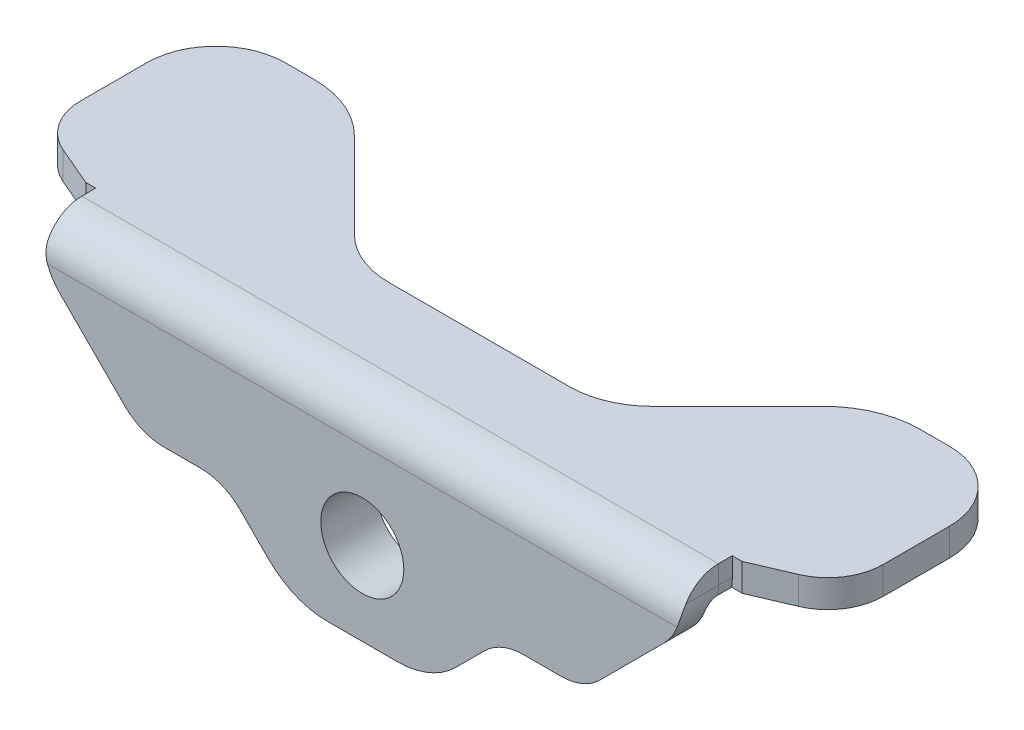
from build123d import *

# Parameters (mm, degrees)
BASE_FLANGE1_DEPTH   = 2
EDGE_FLANGE1_START   = -23
EDGE_FLANGE1_DEPTH   = 46
EDGE_FLANGE1_START_2 = -23.714787909
EDGE_FLANGE1_2_DEPTH = 0.714787909
EDGE_FLANGE1_START_3 = 23
EDGE_FLANGE1_3_DEPTH = 0.714787909
EDGE_FLANGE1_4_DEPTH = 46
CUT_EXTRUDE1_DEPTH   = 10
FILLET1_R            = 4
FILLET2_R            = 6
SKETCH9_R            = 3
CUT_EXTRUDE2_DEPTH   = 10
SKETCH10_R           = 3
BOSS_EXTRUDE1_DEPTH  = 2


# Read off the part's stored shape, not the designer's step: Edge-Flange1
# Sheet-metal steps are written as plain solids
with BuildPart() as part:
    # Sketch1 → Base-Flange1 (new body)
    with BuildSketch(Plane(origin=(0, 0, 0), x_dir=(1, 0, 0), z_dir=(0, 1, 0))):
        with BuildLine():
            Line((-16.949747468, 6.379735664), (-9, -1.570011804))
            Line((-9, -1.570011804), (9, -1.570011804))
            Line((9, -1.570011804), (16.949747468, 6.379735664))
            ThreePointArc((16.949747468, 6.379735664), (19.22071091, 7.897144924), (21.899494937, 8.429988196))
            Line((21.899494937, 8.429988196), (24, 8.429988196))
            ThreePointArc((24, 8.429988196), (27.535533906, 6.965522102), (29, 3.429988196))
            Line((29, 3.429988196), (29, -1.361639596))
            ThreePointArc((29, -1.361639596), (28.339066725, -3.564054954), (26.574683296, -5.038645514))
            Line((26.574683296, -5.038645514), (23, -6.569508994))
            Line((23, -6.569508994), (23, -10))
            Line((23, -10), (-23, -10))
            Line((-23, -10), (-23, -6.569508994))
            Line((-23, -6.569508994), (-26.574683296, -5.038645514))
            ThreePointArc((-26.574683296, -5.038645514), (-28.339066725, -3.564054954), (-29, -1.361639596))
            Line((-29, -1.361639596), (-29, 3.429988196))
            ThreePointArc((-29, 3.429988196), (-27.535533906, 6.965522102), (-24, 8.429988196))
            Line((-24, 8.429988196), (-21.899494937, 8.429988196))
            ThreePointArc((-21.899494937, 8.429988196), (-19.22071091, 7.897144924), (-16.949747468, 6.379735664))
        make_face()
    extrude(amount=-BASE_FLANGE1_DEPTH)

    # Edge-Flange1 outline → Edge-Flange1 (cut)
    with BuildSketch(Plane.YZ.offset(EDGE_FLANGE1_START)):
        with BuildLine():
            ThreePointArc((-2, 9.899002398), (-0.556604688, 8.917667209), (0, 7.2634))
            Line((0, 7.2634), (0, 10))
            Line((0, 10), (-2, 10))
            Line((-2, 10), (-2, 9.899002398))
        make_face()
    extrude(amount=EDGE_FLANGE1_DEPTH, mode=Mode.SUBTRACT)

    # Edge-Flange1 2 outline → Edge-Flange1 2 (cut)
    with BuildSketch(Plane.YZ.offset(EDGE_FLANGE1_START_2)):
        with BuildLine():
            Line((-2, 6.2634), (0, 6.2634))
            Line((0, 6.2634), (0, 7.2634))
            ThreePointArc((0, 7.2634), (-0.556604688, 8.917667209), (-2, 9.899002398))
            Line((-2, 9.899002398), (-2, 6.2634))
        make_face()
    extrude(amount=EDGE_FLANGE1_2_DEPTH, mode=Mode.SUBTRACT)

    # Edge-Flange1 3 outline → Edge-Flange1 3 (cut)
    with BuildSketch(Plane.YZ.offset(EDGE_FLANGE1_START_3)):
        with BuildLine():
            Line((-2, 6.2634), (0, 6.2634))
            Line((0, 6.2634), (0, 7.2634))
            ThreePointArc((0, 7.2634), (-0.556604688, 8.917667209), (-2, 9.899002398))
            Line((-2, 9.899002398), (-2, 6.2634))
        make_face()
    extrude(amount=EDGE_FLANGE1_3_DEPTH, mode=Mode.SUBTRACT)

    # Edge-Flange1 4 outline → Edge-Flange1 4 (add)
    with BuildSketch(Plane.YZ.offset(EDGE_FLANGE1_START)):
        with BuildLine():
            ThreePointArc((-2.7366, 8), (-2.215745145, 7.784254855), (-2, 7.2634))
            Line((-2, 7.2634), (-2, 9.899002398))
            ThreePointArc((-2, 9.899002398), (-2.364854094, 9.974633029), (-2.7366, 10))
            Line((-2.7366, 10), (-15, 10))
            Line((-15, 10), (-15, 8))
            Line((-15, 8), (-2.7366, 8))
        make_face()
    extrude(amount=EDGE_FLANGE1_4_DEPTH)

    # Sketch8 → Cut-Extrude1 (cut)
    with BuildSketch(Plane.XY.offset(10)):
        Polygon((-16, -10), (-23, -3), (-23, -15), (-5, -15), (-10, -10), align=None)
        Polygon((10, -10), (5, -15), (23, -15), (23, -3), (16, -10), align=None)
    extrude(amount=-CUT_EXTRUDE1_DEPTH, mode=Mode.SUBTRACT)

    # Fillet1
    fillet1_edges = [part.edges().sort_by_distance(p)[0] for p in [
        (-23, -3, 9),
        (-16, -10, 9),
        (-10, -10, 9),
        (10, -10, 9),
        (16, -10, 9),
        (23, -3, 9),
    ]]
    fillet(fillet1_edges, radius=FILLET1_R)

    # Fillet2
    fillet2_edges = [part.edges().sort_by_distance(p)[0] for p in [
        (-5, -15, 9),
        (5, -15, 9),
        (9, -1, 1.570011804),
        (-9, -1, 1.570011804),
    ]]
    fillet(fillet2_edges, radius=FILLET2_R)

    # Sketch9 → Cut-Extrude2 (cut)
    with BuildSketch(Plane.XY.offset(10)):
        with Locations((0, -9)):
            Circle(SKETCH9_R)
    extrude(amount=-CUT_EXTRUDE2_DEPTH, mode=Mode.SUBTRACT)

    # Sketch10 → Boss-Extrude1 (add)
    with BuildSketch(Plane(origin=(0, 0, 8), x_dir=(-1, 0, 0), z_dir=(0, 0, -1))):
        Polygon((5.42709253, -9), (2.713546265, -4.3), (-2.713546265, -4.3), (-5.42709253, -9), (-2.713546265, -13.7), (2.713546265, -13.7), align=None)
        with Locations(Location((0, -9, 0), (0, 0, 180))):
            Circle(SKETCH10_R, mode=Mode.SUBTRACT)
    extrude(amount=BOSS_EXTRUDE1_DEPTH)


solid = part.part
